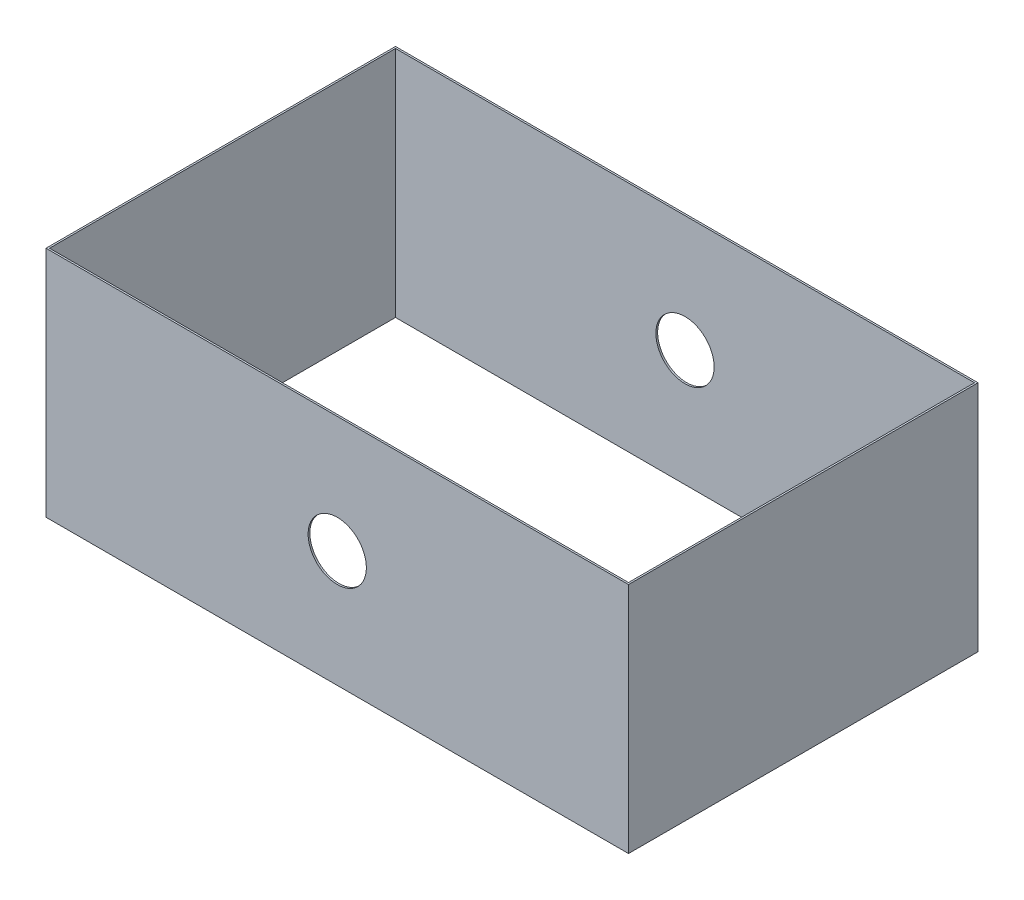
from build123d import *

# Parameters (mm, degrees)
SKETCH1_W           = 500
SKETCH1_H           = 200
SKETCH1_R           = 25
BOSS_EXTRUDE1_DEPTH = 300
SKETCH2_W           = 497
SKETCH2_H           = 297
CUT_EXTRUDE1_DEPTH  = 439.74821937


with BuildPart() as part:
    # Sketch1 → Boss-Extrude1 (new body)
    with BuildSketch(Plane.XY):
        Rectangle(SKETCH1_W, SKETCH1_H)
        Circle(SKETCH1_R, mode=Mode.SUBTRACT)
    extrude(amount=BOSS_EXTRUDE1_DEPTH)

    # Sketch2 → Cut-Extrude1 (cut, through all)
    with BuildSketch(Plane(origin=(0, 100, 0), x_dir=(1, 0, 0), z_dir=(0, 1, 0))):
        with Locations((0, -150)):
            Rectangle(SKETCH2_W, SKETCH2_H)
    extrude(amount=-CUT_EXTRUDE1_DEPTH, mode=Mode.SUBTRACT)


solid = part.part
